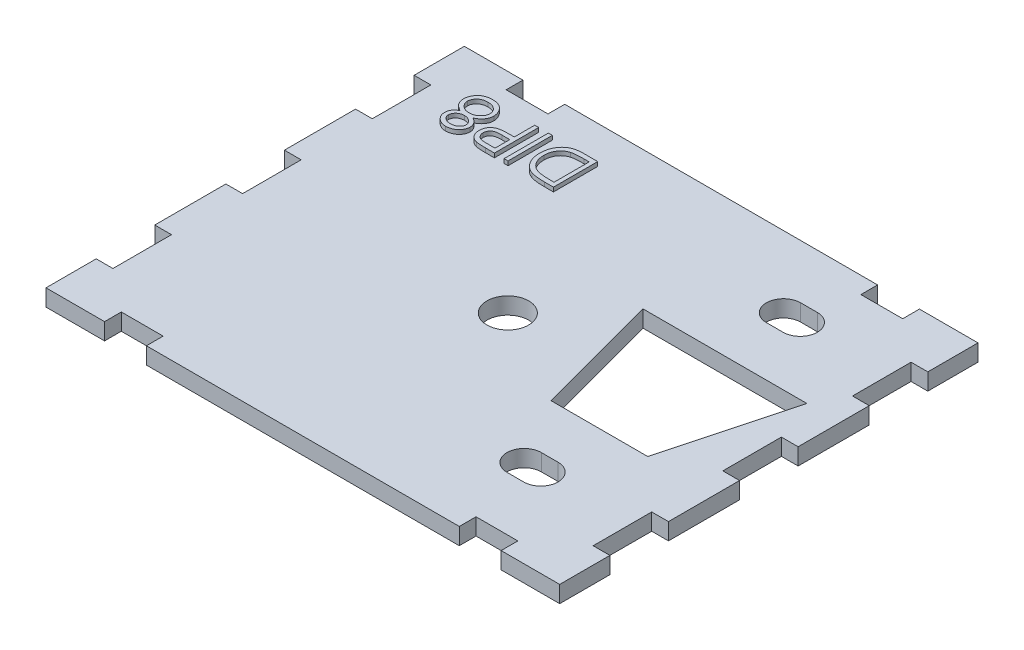
from build123d import *

# Parameters (mm, degrees)
SKETCH2_W           = 100
SKETCH2_H           = 50
BOSS_EXTRUDE1_DEPTH = 2
SKETCH12_W          = 9.8
SKETCH12_H          = 50
SKETCH12_W_2        = 8.8
CUT_EXTRUDE8_DEPTH  = 6
SKETCH13_W          = 5
SKETCH13_H          = 2
CUT_EXTRUDE10_DEPTH = 6
CUT_EXTRUDE13_DEPTH = 10
SKETCH16_R          = 2.5
CUT_EXTRUDE14_DEPTH = 10
CUT_EXTRUDE15_DEPTH = 3.5
SKETCH22_W          = 0.474893163
SKETCH22_H          = 5.291666667
BOSS_EXTRUDE4_DEPTH = 0.5


with BuildPart() as part:
    # Sketch2 → Boss-Extrude1 (new body)
    with BuildSketch(Plane(origin=(0, 0, 0), x_dir=(1, 0, 0), z_dir=(0, 1, 0))):
        Rectangle(SKETCH2_W, SKETCH2_H)
    extrude(amount=BOSS_EXTRUDE1_DEPTH)

    # Sketch12 → Cut-Extrude8 (cut)
    with BuildSketch(Plane(origin=(0, 2, 0), x_dir=(1, 0, 0), z_dir=(0, 1, 0))):
        with Locations((-45.1, 0)):
            Rectangle(SKETCH12_W, SKETCH12_H)
        with Locations((45.6, 0)):
            Rectangle(SKETCH12_W_2, SKETCH12_H)
    extrude(amount=-CUT_EXTRUDE8_DEPTH, mode=Mode.SUBTRACT)

    # Sketch13 → Cut-Extrude10 (cut)
    with BuildSketch(Plane(origin=(0, 2, 0), x_dir=(1, 0, 0), z_dir=(0, 1, 0))):
        Polygon((-28.2, 12), (-28.2, 19), (-30.2, 19), (-30.2, 25), (-40.2, 25), (-40.2, -25), (-30.2, -25), (-30.2, -19), (-28.2, -19), (-28.2, -12), (-30.2, -12), (-30.2, -3.5), (-28.2, -3.5), (-28.2, 3.5), (-30.2, 3.5), (-30.2, 12), align=None)
        with Locations((-20.7, 24)):
            Rectangle(SKETCH13_W, SKETCH13_H)
        with Locations((21.7, 24)):
            Rectangle(SKETCH13_W, SKETCH13_H)
        with Locations((-20.7, -24)):
            Rectangle(SKETCH13_W, SKETCH13_H)
        Polygon((41.2, 25), (31.2, 25), (31.2, 19), (29.2, 19), (29.2, 12), (31.2, 12), (31.2, 3.5), (29.2, 3.5), (29.2, -3.5), (31.2, -3.5), (31.2, -12), (29.2, -12), (29.2, -19), (31.2, -19), (31.2, -25), (41.2, -25), align=None)
        with Locations((21.7, -24)):
            Rectangle(SKETCH13_W, SKETCH13_H)
    extrude(amount=-CUT_EXTRUDE10_DEPTH, mode=Mode.SUBTRACT)

    # Sketch15 → Cut-Extrude13 (cut)
    with BuildSketch(Plane.XZ):
        Polygon((7.666108138, -8.5), (27.239237886, -8.5), (23.22, 6.5), (11.685346024, 6.5), align=None)
    extrude(amount=-CUT_EXTRUDE13_DEPTH, mode=Mode.SUBTRACT)

    # Sketch16 → Cut-Extrude14 (cut)
    with BuildSketch(Plane(origin=(0, 0, 0), x_dir=(-1, 0, 0), z_dir=(0, -1, 0))):
        Circle(SKETCH16_R)
    extrude(amount=-CUT_EXTRUDE14_DEPTH, mode=Mode.SUBTRACT)

    # Sketch17 → Cut-Extrude15 (cut)
    with BuildSketch(Plane(origin=(0, 0, 0), x_dir=(-1, 0, 0), z_dir=(0, -1, 0))):
        with BuildLine():
            Line((-16.452672903, 18.55), (-18.452672903, 18.55))
            ThreePointArc((-18.452672903, 18.55), (-20.502672903, 16.5), (-18.452672903, 14.45))
            Line((-18.452672903, 14.45), (-16.452672903, 14.45))
            ThreePointArc((-16.452672903, 14.45), (-14.402672903, 16.5), (-16.452672903, 18.55))
        make_face()
        with BuildLine():
            Line((-16.452672874, -12.45), (-18.452672874, -12.45))
            ThreePointArc((-18.452672874, -12.45), (-20.502672874, -14.5), (-18.452672874, -16.55))
            Line((-18.452672874, -16.55), (-16.452672874, -16.55))
            ThreePointArc((-16.452672874, -16.55), (-14.402672874, -14.5), (-16.452672874, -12.45))
        make_face()
    extrude(amount=-CUT_EXTRUDE15_DEPTH, mode=Mode.SUBTRACT)

    # Sketch22 → Boss-Extrude4 (add)
    # profile 1 of 4: a face of its own
    with BuildSketch(Plane(origin=(0, 2, 0), x_dir=(1, 0, 0), z_dir=(0, 1, 0))):
        with BuildLine():
            add(Edge.make_bspline(
                [(-23.289435803, 17.591903377), (-23.332404905, 17.61448406), (-23.416471147, 17.658661691), (-23.536226688, 17.730009944), (-23.647999479, 17.802604298), (-23.749722211, 17.879054809), (-23.842392171, 17.957736407), (-23.926294543, 18.038440897), (-24.002331643, 18.120913039), (-24.067891265, 18.207273039), (-24.126059508, 18.295985161), (-24.175335145, 18.388142762), (-24.218340263, 18.482414147), (-24.252093921, 18.580230551), (-24.279961434, 18.680250068), (-24.299121538, 18.783814795), (-24.309429202, 18.890228595), (-24.31137761, 18.962147422), (-24.312364155, 18.998562365)],
                knots=[0, 0, 0, 0, 1.264219729, 2.473363326, 3.62979159, 4.734286947, 5.785533755, 6.79450939, 7.765315851, 8.704182021, 9.615576613, 10.525715488, 11.423813905, 12.311666436, 13.218214638, 14.126256791, 15.051260205, 16, 16, 16, 16], degree=3))
            add(Edge.make_bspline(
                [(-24.312364155, 18.998562365), (-24.311204378, 19.049512323), (-24.308908743, 19.150361407), (-24.288705392, 19.299170633), (-24.258862371, 19.444279836), (-24.213527962, 19.584044036), (-24.15774182, 19.719654049), (-24.087347083, 19.849282845), (-24.007897509, 19.976651469), (-23.944003353, 20.054992402), (-23.911673049, 20.094632744)],
                knots=[0, 0, 0, 0, 1.02531512, 2.029483338, 3.018748588, 4.004195107, 4.983200899, 5.966616707, 6.971112471, 8, 8, 8, 8], degree=3))
            add(Edge.make_bspline(
                [(-23.911673049, 20.094632744), (-23.869586951, 20.140887617), (-23.785934825, 20.232825779), (-23.642632065, 20.352191884), (-23.485360884, 20.452505849), (-23.314729833, 20.534257404), (-23.131195025, 20.597887215), (-22.934795566, 20.643611021), (-22.725148573, 20.669800885), (-22.581055777, 20.673586679), (-22.50713412, 20.675528845)],
                knots=[0, 0, 0, 0, 0.954267603, 1.896743057, 2.838368354, 3.796610408, 4.779680527, 5.799409237, 6.871065594, 8, 8, 8, 8], degree=3))
            add(Edge.make_bspline(
                [(-22.50713412, 20.675528845), (-22.436055991, 20.673781732), (-22.297745171, 20.670382028), (-22.096400606, 20.64747387), (-21.908487986, 20.606917675), (-21.733116378, 20.552556064), (-21.57198157, 20.480063565), (-21.424790588, 20.391208922), (-21.289386079, 20.287998182), (-21.170015852, 20.167947464), (-21.064068193, 20.039336519), (-20.970919412, 19.906693561), (-20.893932238, 19.770115131), (-20.827575478, 19.631678729), (-20.778193171, 19.488579337), (-20.743167977, 19.342285484), (-20.72116727, 19.193212775), (-20.718224786, 19.09262613), (-20.716744497, 19.04202357)],
                knots=[0, 0, 0, 0, 1.256864279, 2.445730223, 3.576845088, 4.651810441, 5.686528262, 6.692706664, 7.686234615, 8.689148594, 9.678739427, 10.630299996, 11.55097961, 12.448208961, 13.341360817, 14.221834469, 15.105450545, 16, 16, 16, 16], degree=3))
            add(Edge.make_bspline(
                [(-20.716744497, 19.04202357), (-20.717618412, 19.004892494), (-20.719345576, 18.931508382), (-20.731293861, 18.823089499), (-20.750519307, 18.717568868), (-20.776571554, 18.61452999), (-20.812202555, 18.514516547), (-20.854473631, 18.417012756), (-20.904236832, 18.322021441), (-20.963451698, 18.230988823), (-21.028691128, 18.140690304), (-21.106136334, 18.055609622), (-21.190624087, 17.970749255), (-21.287183971, 17.891269556), (-21.390601042, 17.810604383), (-21.505698429, 17.735495922), (-21.628638317, 17.660082318), (-21.716038773, 17.615019626), (-21.760873437, 17.591903377)],
                knots=[0, 0, 0, 0, 0.941575622, 1.860885767, 2.762557628, 3.660168386, 4.552890429, 5.45184204, 6.353736508, 7.268493418, 8.204037487, 9.175167802, 10.182660057, 11.238220596, 12.344046335, 13.507168087, 14.721227736, 16, 16, 16, 16], degree=3))
            add(Edge.make_bspline(
                [(-21.760873437, 17.591903377), (-21.699577858, 17.558340511), (-21.581078052, 17.493455028), (-21.422672491, 17.375729424), (-21.288489585, 17.245915039), (-21.179955341, 17.103816516), (-21.09426206, 16.95410414), (-21.033675933, 16.797566068), (-20.994129984, 16.635948219), (-20.990123942, 16.52574089), (-20.988112018, 16.470392293)],
                knots=[0, 0, 0, 0, 1.16701039, 2.256125286, 3.287752239, 4.277689688, 5.235169525, 6.160862735, 7.076343936, 8, 8, 8, 8], degree=3))
            add(Edge.make_bspline(
                [(-20.988112018, 16.470392293), (-20.99058901, 16.414004539), (-20.995568195, 16.30065532), (-21.035692113, 16.131877426), (-21.101573472, 15.966019636), (-21.18964704, 15.803466302), (-21.301731542, 15.651624337), (-21.434399213, 15.514337341), (-21.587483171, 15.395158449), (-21.757618679, 15.294413112), (-21.940381157, 15.212025645), (-22.133537089, 15.155780959), (-22.333643963, 15.118788779), (-22.46986568, 15.114612288), (-22.538935002, 15.112494657)],
                knots=[0, 0, 0, 0, 0.888724595, 1.786491426, 2.720083884, 3.697804067, 4.69440576, 5.687697823, 6.7000873, 7.744853364, 8.800284131, 9.853047784, 10.91141782, 12, 12, 12, 12], degree=3))
            add(Edge.make_bspline(
                [(-22.538935002, 15.112494657), (-22.606223043, 15.114671942), (-22.738907394, 15.1189653), (-22.934231025, 15.155126734), (-23.121279065, 15.21484513), (-23.299003181, 15.296181802), (-23.463621786, 15.397529675), (-23.610117107, 15.518020117), (-23.739685062, 15.65381121), (-23.846731579, 15.806153981), (-23.932605497, 15.968696476), (-23.994444609, 16.137306704), (-24.0335398, 16.30996329), (-24.038507636, 16.426729958), (-24.040996634, 16.485232704)],
                knots=[0, 0, 0, 0, 1.072634126, 2.115112298, 3.156050586, 4.19761425, 5.225177188, 6.230426315, 7.215180151, 8.209739481, 9.190420596, 10.139012357, 11.067603024, 12, 12, 12, 12], degree=3))
            add(Edge.make_bspline(
                [(-24.040996634, 16.485232704), (-24.038814594, 16.542644763), (-24.034529192, 16.655398782), (-23.998954414, 16.819531188), (-23.938110498, 16.972926268), (-23.856031863, 17.11794444), (-23.748301785, 17.252268321), (-23.617095434, 17.376565011), (-23.464115364, 17.493265493), (-23.348963868, 17.558289128), (-23.289435803, 17.591903377)],
                knots=[0, 0, 0, 0, 0.975463758, 1.915755378, 2.838359076, 3.772025586, 4.738400888, 5.753889765, 6.838863581, 8, 8, 8, 8], degree=3))
        make_face()
        with BuildLine():
            add(Edge.make_bspline(
                [(-22.512434267, 15.655229699), (-22.47531449, 15.656211427), (-22.402691974, 15.658132116), (-22.296228701, 15.668244), (-22.194907486, 15.687667345), (-22.098174266, 15.714277066), (-22.005697671, 15.747384889), (-21.919598353, 15.791005575), (-21.836982884, 15.839490149), (-21.760561541, 15.896360348), (-21.691380821, 15.958406963), (-21.629590243, 16.023204881), (-21.579250098, 16.092664313), (-21.535940626, 16.163310298), (-21.503777294, 16.238073053), (-21.480929572, 16.315315625), (-21.464760061, 16.395527264), (-21.463594687, 16.45017091), (-21.463005181, 16.477812499)],
                knots=[0, 0, 0, 0, 1.20353747, 2.354645537, 3.462130888, 4.543058862, 5.604822423, 6.639552563, 7.666902586, 8.706944258, 9.720926464, 10.677177239, 11.602682187, 12.496457588, 13.358248655, 14.231532794, 15.105417644, 16, 16, 16, 16], degree=3))
            add(Edge.make_bspline(
                [(-21.463005181, 16.477812499), (-21.464080303, 16.505438436), (-21.466204899, 16.560031256), (-21.481582796, 16.640972731), (-21.507294769, 16.719478164), (-21.542551413, 16.796280423), (-21.587796714, 16.871182371), (-21.642711, 16.944471028), (-21.709676985, 17.014208335), (-21.78362764, 17.082372873), (-21.864405646, 17.14517387), (-21.949288635, 17.201271158), (-22.03889609, 17.245991422), (-22.130544476, 17.285201955), (-22.226171939, 17.314614401), (-22.32511912, 17.335804335), (-22.427280324, 17.348911631), (-22.496495028, 17.350482111), (-22.531514796, 17.351276708)],
                knots=[0, 0, 0, 0, 0.873213166, 1.72559466, 2.594724523, 3.479581045, 4.391597569, 5.35687048, 6.368548091, 7.443976143, 8.534559525, 9.600545123, 10.654815915, 11.696401765, 12.749428718, 13.812189468, 14.893058657, 16, 16, 16, 16], degree=3))
            add(Edge.make_bspline(
                [(-22.531514796, 17.351276708), (-22.576496813, 17.349963671), (-22.666016561, 17.347350566), (-22.797934775, 17.322833119), (-22.926524557, 17.284755207), (-23.049352767, 17.230710492), (-23.164221069, 17.164816998), (-23.267889704, 17.087110128), (-23.356020332, 16.995764996), (-23.430997068, 16.896080311), (-23.489618261, 16.790338942), (-23.534523013, 16.683790582), (-23.560967949, 16.575557598), (-23.564405573, 16.503033178), (-23.566103471, 16.467212205)],
                knots=[0, 0, 0, 0, 1.076561449, 2.142489767, 3.202892658, 4.283174188, 5.348766409, 6.369549039, 7.375093932, 8.378927502, 9.349008457, 10.26378795, 11.142457041, 12, 12, 12, 12], degree=3))
            add(Edge.make_bspline(
                [(-23.566103471, 16.467212205), (-23.565314167, 16.442066926), (-23.563747511, 16.392157152), (-23.550314376, 16.318212536), (-23.529362787, 16.245904034), (-23.498822884, 16.175656129), (-23.46187911, 16.1058369), (-23.414787797, 16.03863664), (-23.360211652, 15.972021681), (-23.297362791, 15.908184689), (-23.22635654, 15.848252806), (-23.146618515, 15.796301252), (-23.058852377, 15.752979436), (-22.964234769, 15.716583757), (-22.861765786, 15.689552381), (-22.752327664, 15.669210289), (-22.634932936, 15.65776836), (-22.554152771, 15.656094273), (-22.512434267, 15.655229699)],
                knots=[0, 0, 0, 0, 0.814035228, 1.61574325, 2.427118093, 3.24780647, 4.092880925, 4.981933388, 5.900917883, 6.880367106, 7.87994501, 8.905470125, 9.95492938, 11.0455354, 12.184050453, 13.382997595, 14.64846247, 16, 16, 16, 16], degree=3))
        make_face(mode=Mode.SUBTRACT)
        with BuildLine():
            add(Edge.make_bspline(
                [(-22.543175119, 17.894011751), (-22.496116025, 17.894849043), (-22.403797565, 17.896491606), (-22.268545382, 17.914766395), (-22.138750223, 17.940223154), (-22.014810536, 17.978778768), (-21.897362521, 18.028944861), (-21.784753311, 18.088433254), (-21.678746335, 18.159735969), (-21.579815409, 18.241123996), (-21.489241489, 18.329322244), (-21.409489888, 18.422471375), (-21.342111092, 18.519306541), (-21.287432444, 18.619950223), (-21.245014196, 18.724180672), (-21.213708873, 18.832058714), (-21.195533045, 18.943885259), (-21.192943361, 19.019699148), (-21.191637659, 19.05792401)],
                knots=[0, 0, 0, 0, 1.140332253, 2.237053636, 3.304055028, 4.344690294, 5.377465719, 6.397042765, 7.428360044, 8.469453732, 9.499453352, 10.490108612, 11.438398528, 12.354680514, 13.261581007, 14.161901135, 15.073242693, 16, 16, 16, 16], degree=3))
            add(Edge.make_bspline(
                [(-21.191637659, 19.05792401), (-21.193736865, 19.105436245), (-21.197916883, 19.200044447), (-21.229889104, 19.339513735), (-21.282396734, 19.474495236), (-21.356058748, 19.603085246), (-21.445909182, 19.723724669), (-21.555139911, 19.83036229), (-21.681087775, 19.921562602), (-21.822718051, 19.997787354), (-21.977972565, 20.058158391), (-22.145891871, 20.101349747), (-22.325338543, 20.12849734), (-22.449086216, 20.131339079), (-22.512434267, 20.132793802)],
                knots=[0, 0, 0, 0, 0.899105568, 1.790333855, 2.694925079, 3.632758987, 4.588257081, 5.534574046, 6.511571685, 7.523527334, 8.572244311, 9.657983075, 10.801090915, 12, 12, 12, 12], degree=3))
            add(Edge.make_bspline(
                [(-22.512434267, 20.132793802), (-22.561946272, 20.131832001), (-22.658411534, 20.129958104), (-22.79919616, 20.113761674), (-22.931741394, 20.087305183), (-23.05731706, 20.051433018), (-23.174988471, 20.00388132), (-23.284595238, 19.944817552), (-23.387629904, 19.877353963), (-23.479688966, 19.797482909), (-23.563393287, 19.71201594), (-23.636711674, 19.622016397), (-23.698761577, 19.528385631), (-23.74877976, 19.431178451), (-23.788498975, 19.330752085), (-23.817132006, 19.226694282), (-23.834779351, 19.118596315), (-23.836565569, 19.045270882), (-23.837470993, 19.00810263)],
                knots=[0, 0, 0, 0, 1.224631902, 2.385975653, 3.500340538, 4.565441647, 5.612488581, 6.63322211, 7.641830068, 8.652595074, 9.641693811, 10.598750962, 11.520088299, 12.415429315, 13.298523938, 14.187139574, 15.081071174, 16, 16, 16, 16], degree=3))
            add(Edge.make_bspline(
                [(-23.837470993, 19.00810263), (-23.836110484, 18.971998254), (-23.833427799, 18.900806732), (-23.816156573, 18.795386006), (-23.786507588, 18.69311897), (-23.743274369, 18.594466875), (-23.69018178, 18.49828214), (-23.624595492, 18.40537225), (-23.547314869, 18.315479941), (-23.45852907, 18.230455999), (-23.362305315, 18.151855224), (-23.260329144, 18.082004429), (-23.152135819, 18.024914734), (-23.039868607, 17.976955371), (-22.922395756, 17.939580332), (-22.800283876, 17.913372465), (-22.673301633, 17.896900838), (-22.587040661, 17.89498566), (-22.543175119, 17.894011751)],
                knots=[0, 0, 0, 0, 0.917336384, 1.808827106, 2.706624561, 3.615530867, 4.539869921, 5.493819324, 6.499753197, 7.547410123, 8.613069608, 9.653934021, 10.682176708, 11.716048074, 12.752411263, 13.808993382, 14.885826486, 16, 16, 16, 16], degree=3))
        make_face(mode=Mode.SUBTRACT)
    # profile 2 of 4: a face of its own
    with BuildSketch(Plane(origin=(0, 2, 0), x_dir=(1, 0, 0), z_dir=(0, 1, 0))):
        with BuildLine():
            Line((-16.849757317, 15.248178417), (-17.887526081, 15.248178417))
            add(Edge.make_bspline(
                [(-17.887526081, 15.248178417), (-17.958904475, 15.24825688), (-18.095668647, 15.248407217), (-18.291785458, 15.252965225), (-18.469902552, 15.2590532), (-18.629635866, 15.267492491), (-18.771476871, 15.277465907), (-18.894783741, 15.29145411), (-19.000525689, 15.306059556), (-19.06388425, 15.320908588), (-19.092779486, 15.327680621)],
                knots=[0, 0, 0, 0, 1.415646017, 2.712440637, 3.8905458, 4.950247383, 5.884950622, 6.709939814, 7.411656543, 8, 8, 8, 8], degree=3))
            add(Edge.make_bspline(
                [(-19.092779486, 15.327680621), (-19.129357573, 15.337692681), (-19.201651829, 15.357480878), (-19.305827007, 15.39710916), (-19.404925695, 15.44411866), (-19.499362415, 15.497616299), (-19.587519359, 15.560128491), (-19.672148956, 15.628047242), (-19.7514764, 15.704119349), (-19.824303874, 15.788244656), (-19.891781673, 15.877667251), (-19.948265428, 15.974667362), (-19.998142805, 16.075880016), (-20.0370127, 16.18377635), (-20.06756593, 16.296932148), (-20.089817881, 16.415641918), (-20.104119685, 16.539649576), (-20.105476746, 16.624409671), (-20.106167574, 16.667557758)],
                knots=[0, 0, 0, 0, 0.999333726, 1.975119402, 2.933498163, 3.889020618, 4.832249799, 5.779334906, 6.747801194, 7.724875447, 8.710438469, 9.696133548, 10.679360639, 11.681339199, 12.714023775, 13.766351759, 14.862936069, 16, 16, 16, 16], degree=3))
            add(Edge.make_bspline(
                [(-20.106167574, 16.667557758), (-20.10553042, 16.711067015), (-20.104283785, 16.796195817), (-20.089321544, 16.920735628), (-20.069167564, 17.039750337), (-20.038177973, 17.152976053), (-19.997589872, 17.259740373), (-19.949976887, 17.361674855), (-19.892549407, 17.457045311), (-19.826562581, 17.546197977), (-19.753157194, 17.629216535), (-19.672643823, 17.705499379), (-19.585347512, 17.774599986), (-19.491545693, 17.836673267), (-19.390323898, 17.890279785), (-19.283217308, 17.938293806), (-19.169294957, 17.978617909), (-19.090460442, 17.999830026), (-19.050378311, 18.010614983)],
                knots=[0, 0, 0, 0, 1.121902311, 2.195077645, 3.232258892, 4.234102512, 5.217864754, 6.176164875, 7.132989551, 8.084763148, 9.034132444, 9.988522005, 10.94243251, 11.903244335, 12.886203696, 13.894208494, 14.929344452, 16, 16, 16, 16], degree=3))
            add(Edge.make_bspline(
                [(-19.050378311, 18.010614983), (-19.017225893, 18.017659712), (-18.944570441, 18.033098645), (-18.824921685, 18.050451574), (-18.685544292, 18.064682872), (-18.526912485, 18.077963633), (-18.348656338, 18.085000776), (-18.151184687, 18.09326353), (-17.933829219, 18.097162272), (-17.782230557, 18.097408721), (-17.703080969, 18.097537392)],
                knots=[0, 0, 0, 0, 0.601372724, 1.317943291, 2.144091499, 3.08771165, 4.142394186, 5.309582461, 6.595334295, 8, 8, 8, 8], degree=3))
            Line((-17.703080969, 18.097537392), (-17.32465048, 18.097537392))
            Line((-17.32465048, 18.097537392), (-17.32465048, 20.539845084))
            Line((-17.32465048, 20.539845084), (-16.849757317, 20.539845084))
            Line((-16.849757317, 20.539845084), (-16.849757317, 15.248178417))
        make_face()
        with BuildLine():
            Line((-17.32465048, 15.79091346), (-17.32465048, 17.554802349))
            Line((-17.32465048, 17.554802349), (-18.251116158, 17.566462672))
            add(Edge.make_bspline(
                [(-18.251116158, 17.566462672), (-18.296352998, 17.5664925), (-18.383681785, 17.566550082), (-18.510171515, 17.560421484), (-18.627242279, 17.553754261), (-18.735066925, 17.542971778), (-18.833153313, 17.529820509), (-18.921738923, 17.512237197), (-19.001530711, 17.494303354), (-19.093442015, 17.463184955), (-19.196392314, 17.4162389), (-19.308129847, 17.346119114), (-19.403600406, 17.257785816), (-19.485518732, 17.157394105), (-19.550269573, 17.045594913), (-19.597197314, 16.926308405), (-19.625841034, 16.799987531), (-19.629441306, 16.713641524), (-19.631274411, 16.669677816)],
                knots=[0, 0, 0, 0, 1.160501667, 2.240324542, 3.248665471, 4.168823117, 5.020172044, 5.786515869, 6.485785279, 7.116517804, 8.272762037, 9.381837012, 10.485674779, 11.594342068, 12.695271952, 13.786226926, 14.872841088, 16, 16, 16, 16], degree=3))
            add(Edge.make_bspline(
                [(-19.631274411, 16.669677816), (-19.629359524, 16.627138412), (-19.625552964, 16.54257534), (-19.597433922, 16.418581872), (-19.549772594, 16.300651465), (-19.485465943, 16.189738386), (-19.405510669, 16.089613502), (-19.311938821, 16.003248829), (-19.206206234, 15.933346739), (-19.108619451, 15.886813583), (-19.021286965, 15.859525505), (-18.945795973, 15.839824894), (-18.860125246, 15.826237802), (-18.765085548, 15.81323751), (-18.660798562, 15.802743445), (-18.546601151, 15.795456031), (-18.422873698, 15.791235826), (-18.336981928, 15.791023517), (-18.292457304, 15.79091346)],
                knots=[0, 0, 0, 0, 1.12039168, 2.227199994, 3.330242575, 4.460839274, 5.593542475, 6.693949254, 7.801736126, 8.92216649, 9.528704869, 10.210659466, 10.975987387, 11.81211542, 12.738540127, 13.736887663, 14.826846554, 16, 16, 16, 16], degree=3))
            Line((-18.292457304, 15.79091346), (-17.32465048, 15.79091346))
        make_face(mode=Mode.SUBTRACT)
    # profile 3 of 4: a face of its own
    with BuildSketch(Plane(origin=(0, 2, 0), x_dir=(1, 0, 0), z_dir=(0, 1, 0))):
        with Locations((-15.458998771, 17.89401175)):
            Rectangle(SKETCH22_W, SKETCH22_H)
    # profile 4 of 4: a face of its own
    with BuildSketch(Plane(origin=(0, 2, 0), x_dir=(1, 0, 0), z_dir=(0, 1, 0))):
        with BuildLine():
            Line((-9.794201762, 20.539845084), (-9.794201762, 15.248178417))
            Line((-9.794201762, 15.248178417), (-10.862711377, 15.248178417))
            add(Edge.make_bspline(
                [(-10.862711377, 15.248178417), (-10.955646826, 15.248845718), (-11.135197631, 15.250134939), (-11.394656719, 15.258355989), (-11.634380243, 15.272752196), (-11.854232067, 15.294126465), (-12.054565401, 15.319781578), (-12.235059386, 15.352408477), (-12.396006529, 15.39077992), (-12.494989894, 15.423507319), (-12.541797916, 15.438983706)],
                knots=[0, 0, 0, 0, 1.314317071, 2.539253741, 3.67075822, 4.709970291, 5.662644612, 6.526156501, 7.303037452, 8, 8, 8, 8], degree=3))
            add(Edge.make_bspline(
                [(-12.541797916, 15.438983706), (-12.60302758, 15.462306224), (-12.724098423, 15.508422383), (-12.896386852, 15.595547119), (-13.059127226, 15.693859614), (-13.211034541, 15.805613833), (-13.352443516, 15.929381688), (-13.485133382, 16.064161799), (-13.605300833, 16.21355234), (-13.717090477, 16.372917778), (-13.814935421, 16.543708371), (-13.901215858, 16.722503207), (-13.974886252, 16.908955371), (-14.032368948, 17.104425318), (-14.079859589, 17.307035637), (-14.111724644, 17.518320336), (-14.132891318, 17.737047608), (-14.135008075, 17.885479957), (-14.136082104, 17.960793602)],
                knots=[0, 0, 0, 0, 0.984696416, 1.947063185, 2.89840987, 3.841051395, 4.778753227, 5.721858861, 6.681155121, 7.65838316, 8.646299769, 9.637283673, 10.641736726, 11.657050558, 12.698485921, 13.768600492, 14.86780186, 16, 16, 16, 16], degree=3))
            add(Edge.make_bspline(
                [(-14.136082104, 17.960793602), (-14.135130523, 18.026200252), (-14.133255335, 18.155090889), (-14.116438052, 18.345051132), (-14.09194744, 18.529361241), (-14.054204692, 18.707211928), (-14.007827279, 18.879800613), (-13.950585726, 19.046310112), (-13.882739951, 19.206853596), (-13.804058122, 19.360155912), (-13.71790473, 19.505844287), (-13.624026466, 19.641610381), (-13.525637661, 19.768951073), (-13.4191499, 19.884989597), (-13.308088882, 19.993339426), (-13.188677268, 20.089194152), (-13.064653977, 20.177003811), (-12.932292989, 20.254101774), (-12.790508332, 20.322682703), (-12.63559639, 20.38059971), (-12.468122548, 20.430441608), (-12.286977089, 20.470152222), (-12.092764151, 20.502160991), (-11.884957268, 20.523477188), (-11.66394557, 20.53793223), (-11.512181182, 20.539195085), (-11.434067213, 20.539845084)],
                knots=[0, 0, 0, 0, 1.105894396, 2.179280415, 3.222964075, 4.248423888, 5.251546139, 6.243661943, 7.223682738, 8.196462441, 9.155694589, 10.083899862, 10.986397372, 11.874737962, 12.745335529, 13.607670254, 14.461432187, 15.313100333, 16.195087267, 17.121790994, 18.106827133, 19.14775296, 20.255889161, 21.433815148, 22.679170477, 24, 24, 24, 24], degree=3))
            Line((-11.434067213, 20.539845084), (-9.794201762, 20.539845084))
        make_face()
        with BuildLine():
            Line((-10.269094924, 19.997110041), (-10.876491759, 19.997110041))
            add(Edge.make_bspline(
                [(-10.876491759, 19.997110041), (-10.963771558, 19.996734943), (-11.131642575, 19.996013492), (-11.373030261, 19.98968284), (-11.593586015, 19.979338482), (-11.793341154, 19.964861876), (-11.972182893, 19.945708137), (-12.130484991, 19.924352629), (-12.267728537, 19.897746959), (-12.350776614, 19.873630628), (-12.389153685, 19.86248631)],
                knots=[0, 0, 0, 0, 1.375205317, 2.645023457, 3.804390687, 4.853969522, 5.800190428, 6.637939096, 7.370582563, 8, 8, 8, 8], degree=3))
            add(Edge.make_bspline(
                [(-12.389153685, 19.86248631), (-12.437457592, 19.845476297), (-12.532911669, 19.811862553), (-12.670300372, 19.750524854), (-12.798499649, 19.677957626), (-12.919646715, 19.596817328), (-13.032962998, 19.505851075), (-13.137923739, 19.404769574), (-13.235357997, 19.294743066), (-13.323705759, 19.175400814), (-13.4036093, 19.048066979), (-13.472645697, 18.912883401), (-13.530842597, 18.770608682), (-13.578589285, 18.62173782), (-13.61581533, 18.466182211), (-13.64202393, 18.30355149), (-13.658265092, 18.133909881), (-13.660203698, 18.018425372), (-13.661188941, 17.959733572)],
                knots=[0, 0, 0, 0, 0.998420628, 1.972994, 2.929372424, 3.86770908, 4.81360496, 5.759023883, 6.706048443, 7.676227424, 8.651287839, 9.634325482, 10.632389399, 11.645655052, 12.680158286, 13.74837235, 14.855672678, 16, 16, 16, 16], degree=3))
            add(Edge.make_bspline(
                [(-13.661188941, 17.959733572), (-13.660412073, 17.897846419), (-13.658885907, 17.776268559), (-13.639735283, 17.597872612), (-13.611689968, 17.426319709), (-13.571348971, 17.261486341), (-13.519231881, 17.103586959), (-13.456869559, 16.951729499), (-13.38115191, 16.807868222), (-13.295431527, 16.670784678), (-13.199194698, 16.542554911), (-13.092868326, 16.4246812), (-12.977573557, 16.316943975), (-12.85384175, 16.219171701), (-12.719942925, 16.133103123), (-12.578142913, 16.05653786), (-12.426444272, 15.991483459), (-12.320892138, 15.956895335), (-12.267250306, 15.939317573)],
                knots=[0, 0, 0, 0, 1.122272916, 2.204715076, 3.251197285, 4.274229216, 5.279697671, 6.265416158, 7.248880903, 8.225321784, 9.195852973, 10.153576302, 11.101466393, 12.055578741, 13.010401466, 13.985536859, 14.976245305, 16, 16, 16, 16], degree=3))
            add(Edge.make_bspline(
                [(-12.267250306, 15.939317573), (-12.222874168, 15.927046307), (-12.128518323, 15.900954229), (-11.974546753, 15.872492059), (-11.801259563, 15.847387638), (-11.607887395, 15.826133221), (-11.394650678, 15.810882152), (-11.161385411, 15.799435045), (-10.907990771, 15.791714303), (-10.732333845, 15.791187091), (-10.641165237, 15.79091346)],
                knots=[0, 0, 0, 0, 0.674548936, 1.434276114, 2.292660221, 3.240891867, 4.284742987, 5.42552168, 6.663806718, 8, 8, 8, 8], degree=3))
            Line((-10.641165237, 15.79091346), (-10.269094924, 15.79091346))
            Line((-10.269094924, 15.79091346), (-10.269094924, 19.997110041))
        make_face(mode=Mode.SUBTRACT)
    extrude(amount=BOSS_EXTRUDE4_DEPTH)


solid = part.part
